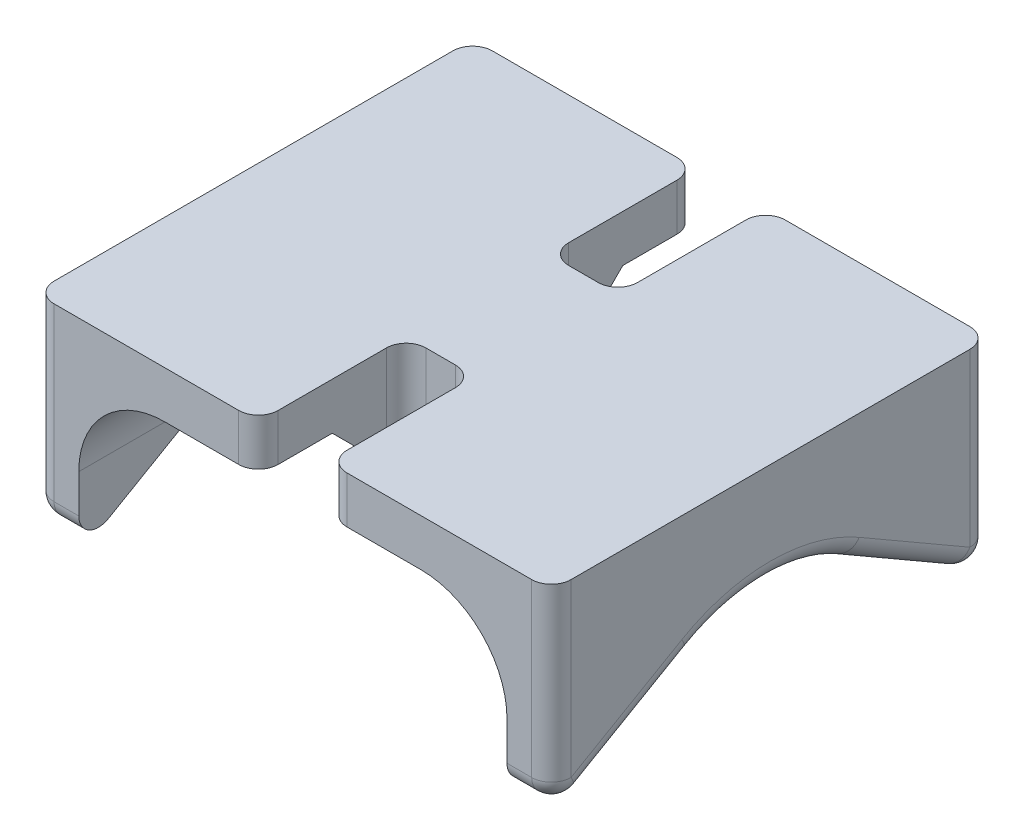
from build123d import *

# Parameters (mm, degrees)
SKETCH23_W          = 26.67
SKETCH23_H          = 22.606
BOSS_EXTRUDE8_DEPTH = 13.208
CUT_EXTRUDE1_DEPTH  = 7.62
SKETCH27_R          = 8.128
CUT_EXTRUDE3_DEPTH  = 38.1
CUT_EXTRUDE4_DEPTH  = 76.2
CHAMFER1_SIZE       = 3.81
FILLET1_R           = 1.016
FILLET2_R           = 1.016
FILLET4_R           = 1.016


with BuildPart() as part:
    # Sketch23 → Boss-Extrude8 (new body)
    with BuildSketch(Plane(origin=(0, 13.462, 0), x_dir=(1, 0, 0), z_dir=(0, 1, 0))):
        with Locations((0, 12.7)):
            Rectangle(SKETCH23_W, SKETCH23_H)
    extrude(amount=-BOSS_EXTRUDE8_DEPTH)

    # Sketch25 → Cut-Extrude1 (cut)
    with BuildSketch(Plane(origin=(0, 0, -24.003), x_dir=(-1, 0, 0), z_dir=(0, 0, -1))):
        with BuildLine():
            Line((1.778, 13.462), (1.778, 11.045488249))
            Line((1.778, 11.045488249), (6.600488249, 11.045488249))
            ThreePointArc((6.600488249, 11.045488249), (9.743577891, 9.743577891), (11.045488249, 6.600488249))
            Line((11.045488249, 6.600488249), (11.045488249, 0.254))
            Line((11.045488249, 0.254), (-11.045488249, 0.254))
            Line((-11.045488249, 0.254), (-11.045488249, 6.600488249))
            ThreePointArc((-11.045488249, 6.600488249), (-9.743577891, 9.743577891), (-6.600488249, 11.045488249))
            Line((-6.600488249, 11.045488249), (-1.778, 11.045488249))
            Line((-1.778, 11.045488249), (-1.778, 13.462))
            ThreePointArc((-1.778, 13.462), (0, 15.24), (1.778, 13.462))
        make_face()
    cut_extrude1 = extrude(amount=-CUT_EXTRUDE1_DEPTH, mode=Mode.SUBTRACT)

    # Sketch27 → Cut-Extrude3 (cut, symmetric)
    with BuildSketch(Plane(origin=(0, 0, 0), x_dir=(0, 0, -1), z_dir=(1, 0, 0))):
        with Locations((12.7, 0)):
            Circle(SKETCH27_R)
    extrude(amount=CUT_EXTRUDE3_DEPTH, both=True, mode=Mode.SUBTRACT)

    # Sketch28 → Cut-Extrude4 (cut)
    with BuildSketch(Plane(origin=(13.335, 0, 0), x_dir=(0, 0, -1), z_dir=(1, 0, 0))):
        with BuildLine():
            Line((1.397, 2.859615883), (8.636, 7.039054482))
            ThreePointArc((8.636, 7.039054482), (12.7, 8.128), (16.764, 7.039054482))
            Line((16.764, 7.039054482), (24.003, 2.859615883))
            Line((24.003, 2.859615883), (24.003, 0.254))
            Line((24.003, 0.254), (1.397, 0.254))
            Line((1.397, 0.254), (1.397, 2.859615883))
        make_face()
    extrude(amount=-CUT_EXTRUDE4_DEPTH, mode=Mode.SUBTRACT)

    # Mirror1: Cut-Extrude1 across plane
    add(cut_extrude1.mirror(Plane.XY.offset(-12.7)), mode=Mode.SUBTRACT)

    # Chamfer1
    # the kernel refuses this chamfer: 3.81 mm, written as the material it adds along each edge
    with BuildSketch(Plane(origin=(8.020112184, 11.045488249, -16.383), x_dir=(0, -1, 0), z_dir=(-1, 0, 0))) as chamfer1_piece_1_section:
        Polygon((CHAMFER1_SIZE, 0), (0, -CHAMFER1_SIZE), (0, 0), align=None)
    chamfer1_piece_1 = extrude(amount=24.418712617, mode=Mode.PRIVATE)
    chamfer1_piece_1 = split(chamfer1_piece_1, bisect_by=Plane(origin=(1.778, 11.045488249, -16.383), z_dir=(1, 0, 0)), keep=Keep.TOP, mode=Mode.PRIVATE)
    chamfer1_piece_1 = chamfer1_piece_1 - Plane(origin=(8.020112184, 0, -12.7), x_dir=(0, 0, -1), z_dir=(1, 0, 0)) * Cylinder(8.128, 65, mode=Mode.PRIVATE)
    add(chamfer1_piece_1)
    with BuildSketch(Plane(origin=(-1.778, 11.045488249, -16.383), x_dir=(0, -1, 0), z_dir=(-1, 0, 0))) as chamfer1_piece_2_section:
        Polygon((CHAMFER1_SIZE, 0), (0, -CHAMFER1_SIZE), (0, 0), align=None)
    chamfer1_piece_2 = extrude(amount=14.620600433, mode=Mode.PRIVATE)
    chamfer1_piece_2 = split(chamfer1_piece_2, bisect_by=Plane(origin=(-13.335, 11.045488249, -16.383), z_dir=(1, 0, 0)), keep=Keep.TOP, mode=Mode.PRIVATE)
    chamfer1_piece_2 = chamfer1_piece_2 - Plane(origin=(-1.778, 0, -12.7), x_dir=(0, 0, -1), z_dir=(1, 0, 0)) * Cylinder(8.128, 45, mode=Mode.PRIVATE)
    add(chamfer1_piece_2)
    with BuildSketch(Plane(origin=(16.398600433, 11.045488249, -16.383), x_dir=(0, -1, 0), z_dir=(-1, 0, 0))) as chamfer1_piece_3_section:
        Polygon((CHAMFER1_SIZE, 0), (0, -CHAMFER1_SIZE), (0, 0), align=None)
    chamfer1_piece_3 = extrude(amount=14.620600433, mode=Mode.PRIVATE)
    chamfer1_piece_3 = split(chamfer1_piece_3, bisect_by=Plane(origin=(13.335, 11.045488249, -16.383), z_dir=(-1, 0, 0)), keep=Keep.TOP, mode=Mode.PRIVATE)
    chamfer1_piece_3 = chamfer1_piece_3 - Plane(origin=(16.398600433, 0, -12.7), x_dir=(0, 0, -1), z_dir=(1, 0, 0)) * Cylinder(8.128, 45, mode=Mode.PRIVATE)
    add(chamfer1_piece_3)
    with BuildSketch(Plane(origin=(16.398600433, 11.045488249, -16.383), x_dir=(0, -1, 0), z_dir=(-1, 0, 0))) as chamfer1_piece_4_section:
        Polygon((CHAMFER1_SIZE, 0), (0, -CHAMFER1_SIZE), (0, 0), align=None)
    chamfer1_piece_4 = extrude(amount=24.418712617, mode=Mode.PRIVATE)
    chamfer1_piece_4 = split(chamfer1_piece_4, bisect_by=Plane(origin=(-1.778, 11.045488249, -16.383), z_dir=(-1, 0, 0)), keep=Keep.TOP, mode=Mode.PRIVATE)
    chamfer1_piece_4 = chamfer1_piece_4 - Plane(origin=(16.398600433, 0, -12.7), x_dir=(0, 0, -1), z_dir=(1, 0, 0)) * Cylinder(8.128, 65, mode=Mode.PRIVATE)
    add(chamfer1_piece_4)
    with BuildSketch(Plane(origin=(8.020112184, 11.045488249, -9.017), x_dir=(0, 0, 1), z_dir=(-1, 0, 0))) as chamfer1_piece_5_section:
        Polygon((CHAMFER1_SIZE, 0), (0, -CHAMFER1_SIZE), (0, 0), align=None)
    chamfer1_piece_5 = extrude(amount=24.418712617, mode=Mode.PRIVATE)
    chamfer1_piece_5 = split(chamfer1_piece_5, bisect_by=Plane(origin=(1.778, 11.045488249, -9.017), z_dir=(1, 0, 0)), keep=Keep.TOP, mode=Mode.PRIVATE)
    chamfer1_piece_5 = chamfer1_piece_5 - Plane(origin=(8.020112184, 0, -12.7), x_dir=(0, 0, -1), z_dir=(1, 0, 0)) * Cylinder(8.128, 65, mode=Mode.PRIVATE)
    add(chamfer1_piece_5)
    with BuildSketch(Plane(origin=(-1.778, 11.045488249, -9.017), x_dir=(0, 0, 1), z_dir=(-1, 0, 0))) as chamfer1_piece_6_section:
        Polygon((CHAMFER1_SIZE, 0), (0, -CHAMFER1_SIZE), (0, 0), align=None)
    chamfer1_piece_6 = extrude(amount=14.620600433, mode=Mode.PRIVATE)
    chamfer1_piece_6 = split(chamfer1_piece_6, bisect_by=Plane(origin=(-13.335, 11.045488249, -9.017), z_dir=(1, 0, 0)), keep=Keep.TOP, mode=Mode.PRIVATE)
    chamfer1_piece_6 = chamfer1_piece_6 - Plane(origin=(-1.778, 0, -12.7), x_dir=(0, 0, -1), z_dir=(1, 0, 0)) * Cylinder(8.128, 45, mode=Mode.PRIVATE)
    add(chamfer1_piece_6)
    with BuildSketch(Plane(origin=(16.398600433, 11.045488249, -9.017), x_dir=(0, -1, 0), z_dir=(-1, 0, 0))) as chamfer1_piece_7_section:
        Polygon((CHAMFER1_SIZE, 0), (0, CHAMFER1_SIZE), (0, 0), align=None)
    chamfer1_piece_7 = extrude(amount=14.620600433, mode=Mode.PRIVATE)
    chamfer1_piece_7 = split(chamfer1_piece_7, bisect_by=Plane(origin=(13.335, 11.045488249, -9.017), z_dir=(-1, 0, 0)), keep=Keep.TOP, mode=Mode.PRIVATE)
    chamfer1_piece_7 = chamfer1_piece_7 - Plane(origin=(16.398600433, 0, -12.7), x_dir=(0, 0, -1), z_dir=(1, 0, 0)) * Cylinder(8.128, 45, mode=Mode.PRIVATE)
    add(chamfer1_piece_7)
    with BuildSketch(Plane(origin=(16.398600433, 11.045488249, -9.017), x_dir=(0, -1, 0), z_dir=(-1, 0, 0))) as chamfer1_piece_8_section:
        Polygon((CHAMFER1_SIZE, 0), (0, CHAMFER1_SIZE), (0, 0), align=None)
    chamfer1_piece_8 = extrude(amount=24.418712617, mode=Mode.PRIVATE)
    chamfer1_piece_8 = split(chamfer1_piece_8, bisect_by=Plane(origin=(-1.778, 11.045488249, -9.017), z_dir=(-1, 0, 0)), keep=Keep.TOP, mode=Mode.PRIVATE)
    chamfer1_piece_8 = chamfer1_piece_8 - Plane(origin=(16.398600433, 0, -12.7), x_dir=(0, 0, -1), z_dir=(1, 0, 0)) * Cylinder(8.128, 65, mode=Mode.PRIVATE)
    add(chamfer1_piece_8)

    # Fillet1
    fillet1_edges = [part.edges().sort_by_distance(p)[0] for p in [
        (12.190244124, 2.859615883, -1.397),
        (-12.190244124, 2.859615883, -24.003),
        (12.190244124, 2.859615883, -24.003),
        (-12.190244124, 2.859615883, -1.397),
    ]]
    fillet(fillet1_edges, radius=FILLET1_R)

    # Fillet2
    fillet2_edges = [part.edges().sort_by_distance(p)[0] for p in [
        (1.778, 10.353840564, -9.017),
        (-1.778, 10.353840564, -9.017),
        (1.778, 12.253744124, -1.397),
        (-1.778, 12.253744124, -1.397),
        (1.778, 10.353840564, -16.383),
        (-1.778, 10.353840564, -16.383),
        (-1.778, 12.253744124, -24.003),
        (1.778, 12.253744124, -24.003),
    ]]
    fillet(fillet2_edges, radius=FILLET2_R)

    # Fillet4
    fillet4_edges = [part.edges().sort_by_distance(p)[0] for p in [
        (13.335, 9.040689752, -1.397),
        (13.335, 5.389276088, -5.7785),
        (13.335, 5.389276088, -19.6215),
        (13.335, 9.040689752, -24.003),
        (13.335, 3.739497694, -23.495),
        (13.335, 3.739497694, -1.905),
        (-13.335, 9.040689752, -1.397),
        (-13.335, 9.040689752, -24.003),
        (-13.335, 3.739497694, -23.495),
        (-13.335, 3.739497694, -1.905),
        (13.335, 8.128, -12.7),
        (-13.335, 8.128, -12.7),
        (-13.335, 5.389276088, -19.6215),
        (-13.335, 5.389276088, -5.7785),
    ]]
    fillet(fillet4_edges, radius=FILLET4_R)


solid = part.part
